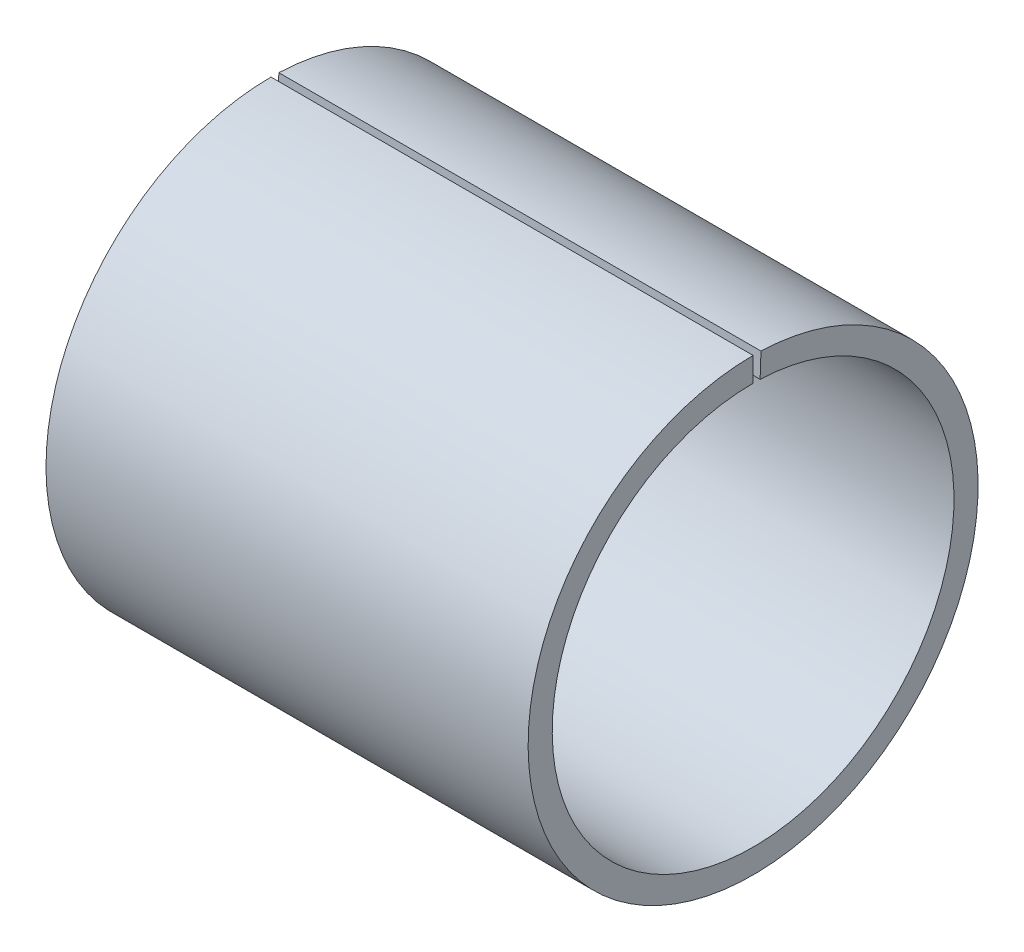
from build123d import *

# Parameters (mm, degrees)
ESQUISSE1_W           = 30
ESQUISSE1_H           = 1.5
BASE_R_VOLUTION_ANGLE = 358


with BuildPart() as part:
    # Esquisse1 → Base-Révolution (revolve)
    with BuildSketch(Plane.XY):
        with Locations((15, 13.25)):
            Rectangle(ESQUISSE1_W, ESQUISSE1_H)
    revolve(axis=Axis((0, 0, 0), (1, 0, 0)), revolution_arc=BASE_R_VOLUTION_ANGLE)


solid = part.part
